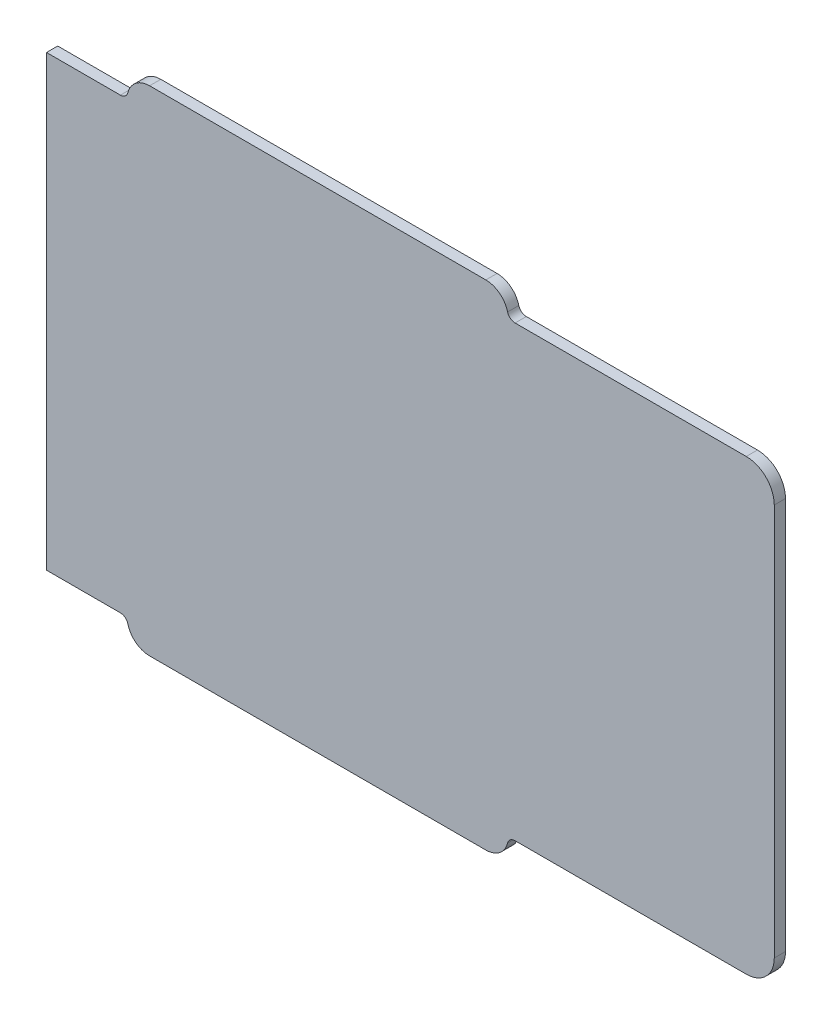
from build123d import *

# Parameters (mm, degrees)
BOSS_EXTRUDE1_DEPTH = 4
SKETCH2_R           = 2.75
CUT_EXTRUDE1_DEPTH  = 3
SKETCH3_R           = 2.35
BOSS_EXTRUDE2_DEPTH = 4
CHAMFER1_SIZE       = 1
CUT_EXTRUDE2_DEPTH  = 2.5


with BuildPart() as part:
    # Sketch1 → Boss-Extrude1 (new body)
    with BuildSketch(Plane.XY):
        with BuildLine():
            Line((120.3, 160), (146.661746787, 160))
            ThreePointArc((146.661746787, 160), (148.349682778, 160.578969808), (149.32688133, 162.072093023))
            ThreePointArc((149.32688133, 162.072093023), (152.169640756, 166.415724194), (157.08, 168.1))
            Line((157.08, 168.1), (277.08, 168.1))
            ThreePointArc((277.08, 168.1), (281.990359244, 166.415724194), (284.83311867, 162.072093023))
            ThreePointArc((284.83311867, 162.072093023), (285.810317222, 160.578969808), (287.498253213, 160))
            Line((287.498253213, 160), (370, 160))
            ThreePointArc((370, 160), (377.071067812, 157.071067812), (380, 150))
            Line((380, 150), (380, 10))
            ThreePointArc((380, 10), (377.071067812, 2.928932188), (370, 0))
            Line((370, 0), (287.498253213, 0))
            ThreePointArc((287.498253213, 0), (285.810317222, -0.578969808), (284.83311867, -2.072093023))
            ThreePointArc((284.83311867, -2.072093023), (281.990359244, -6.415724194), (277.08, -8.1))
            Line((277.08, -8.1), (157.08, -8.1))
            ThreePointArc((157.08, -8.1), (152.169640756, -6.415724194), (149.32688133, -2.072093023))
            ThreePointArc((149.32688133, -2.072093023), (148.349682778, -0.578969808), (146.661746787, 0))
            Line((146.661746787, 0), (120.3, 0))
            Line((120.3, 0), (120.3, 160))
        make_face()
    extrude(amount=BOSS_EXTRUDE1_DEPTH)

    # Sketch2 → Cut-Extrude1 (cut)
    with BuildSketch(Plane(origin=(0, 0, 0), x_dir=(-1, 0, 0), z_dir=(0, 0, -1))):
        with Locations((-126.25, 8.75)):
            Circle(SKETCH2_R)
        with Locations((-126.25, 151.25)):
            Circle(SKETCH2_R)
        with Locations((-370, 10)):
            Circle(SKETCH2_R)
        with Locations((-370, 150)):
            Circle(SKETCH2_R)
    extrude(amount=-CUT_EXTRUDE1_DEPTH, mode=Mode.SUBTRACT)

    # Sketch3 → Boss-Extrude2 (add)
    with BuildSketch(Plane(origin=(0, 0, 0), x_dir=(-1, 0, 0), z_dir=(0, 0, -1))):
        with Locations((-157.08, -0.1)):
            Circle(SKETCH3_R)
        with Locations((-157.08, 160.1)):
            Circle(SKETCH3_R)
        with Locations((-277.08, 160.1)):
            Circle(SKETCH3_R)
        with Locations((-277.08, -0.1)):
            Circle(SKETCH3_R)
    extrude(amount=BOSS_EXTRUDE2_DEPTH)

    # Chamfer1
    chamfer1_edges = [part.edges().sort_by_distance(p)[0] for p in [
        (159.43, -0.1, -4),
        (279.43, -0.1, -4),
        (279.43, 160.1, -4),
        (159.43, 160.1, -4),
    ]]
    chamfer(chamfer1_edges, length=CHAMFER1_SIZE)

    # Sketch4 → Cut-Extrude2 (cut)
    with BuildSketch(Plane(origin=(0, 0, 0), x_dir=(-1, 0, 0), z_dir=(0, 0, -1))):
        with BuildLine():
            ThreePointArc((-370, 15.75), (-365.934136008, 14.065863992), (-364.25, 10))
            Line((-364.25, 10), (-364.25, 3))
            Line((-364.25, 3), (-272.08, 3))
            Line((-272.08, 3), (-272.08, -5.1))
            Line((-272.08, -5.1), (-162.08, -5.1))
            Line((-162.08, -5.1), (-162.08, 3))
            Line((-162.08, 3), (-132, 3))
            Line((-132, 3), (-132, 8.75))
            ThreePointArc((-132, 8.75), (-130.315863992, 12.815863992), (-126.25, 14.5))
            Line((-126.25, 14.5), (-122.867487478, 14.5))
            Line((-122.867487478, 14.5), (-122.867487478, 145.5))
            Line((-122.867487478, 145.5), (-126.25, 145.5))
            ThreePointArc((-126.25, 145.5), (-130.315863992, 147.184136008), (-132, 151.25))
            Line((-132, 151.25), (-132, 157))
            Line((-132, 157), (-162.08, 157))
            Line((-162.08, 157), (-162.08, 165.1))
            Line((-162.08, 165.1), (-272.08, 165.1))
            Line((-272.08, 165.1), (-272.08, 157))
            Line((-272.08, 157), (-364.25, 157))
            Line((-364.25, 157), (-364.25, 150))
            ThreePointArc((-364.25, 150), (-365.934136008, 145.934136008), (-370, 144.25))
            Line((-370, 144.25), (-377, 144.25))
            Line((-377, 144.25), (-377, 15.75))
            Line((-377, 15.75), (-370, 15.75))
        make_face()
    extrude(amount=-CUT_EXTRUDE2_DEPTH, mode=Mode.SUBTRACT)


solid = part.part
